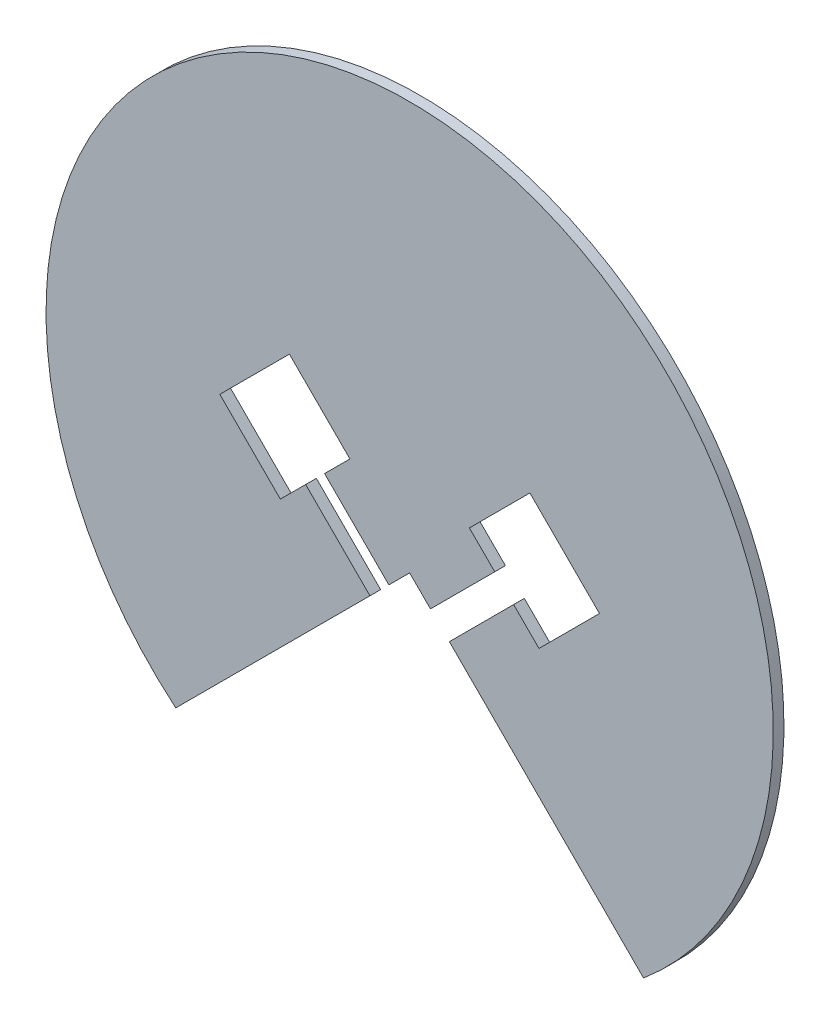
from build123d import *

# Parameters (mm, degrees)
SKETCH1_R           = 215.9
BOSS_EXTRUDE1_DEPTH = 6.35
CUT_EXTRUDE1_DEPTH  = 306.394732273
CUT_EXTRUDE2_DEPTH  = 306.394732273


with BuildPart() as part:
    # Sketch1 → Boss-Extrude1 (new body)
    with BuildSketch(Plane.XY):
        Circle(SKETCH1_R)
    extrude(amount=BOSS_EXTRUDE1_DEPTH)

    # Sketch2 → Cut-Extrude1 (cut, through all)
    with BuildSketch(Plane(origin=(0, 0, 0), x_dir=(-1, 0, 0), z_dir=(0, 0, -1))):
        with BuildLine():
            Line((0, -26.441092948), (138.870288723, -165.311381671))
            ThreePointArc((138.870288723, -165.311381671), (0, -215.9), (-138.870288723, -165.311381671))
            Line((-138.870288723, -165.311381671), (0, -26.441092948))
        make_face()
    extrude(amount=-CUT_EXTRUDE1_DEPTH, mode=Mode.SUBTRACT)

    # Sketch3 → Cut-Extrude2 (cut, through all)
    with BuildSketch(Plane.XY.offset(6.35)):
        Polygon((71.393036162, 50.340096887), (35.472011678, 14.419072403), (50.513940681, -0.6228566), (12.347852166, -38.788945114), (23.573172318, -50.014265265), (61.739260832, -11.848176751), (76.781189835, -26.890105754), (112.702214319, 9.030918731), align=None)
    cut_extrude2 = extrude(amount=-CUT_EXTRUDE2_DEPTH, mode=Mode.SUBTRACT)

    # Mirror1: Cut-Extrude2 across plane
    add(cut_extrude2.mirror(Plane(origin=(0, 0, 0), x_dir=(0, 0, 1), z_dir=(1, 0, 0))), mode=Mode.SUBTRACT)


solid = part.part
